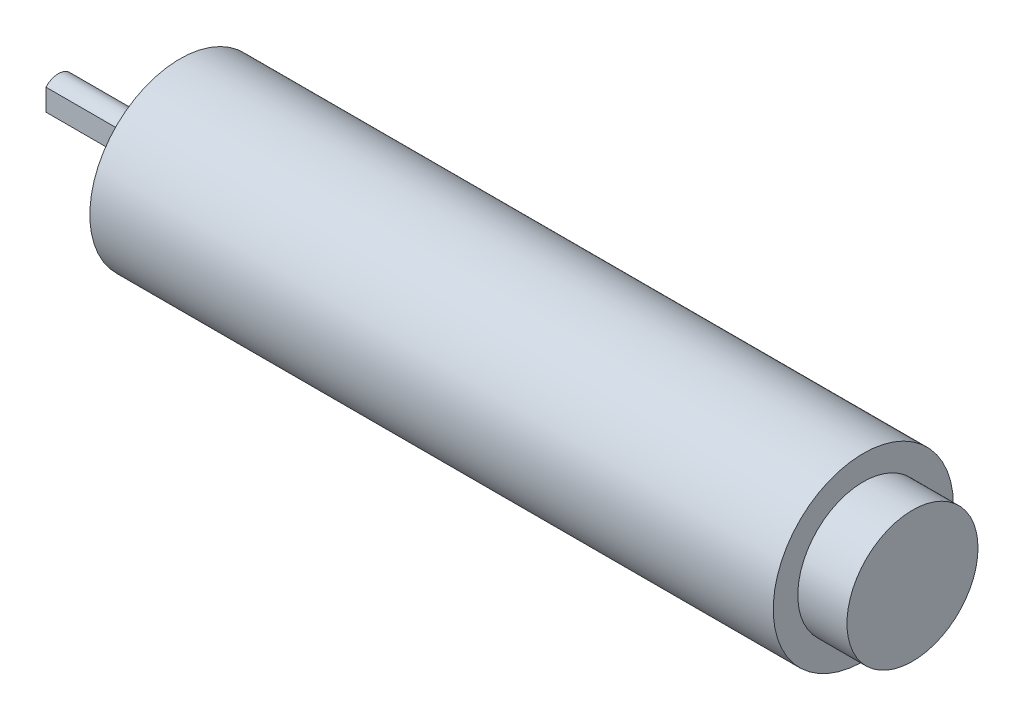
from build123d import *

# Parameters (mm, degrees)
SKETCH1_W           = 52.6
SKETCH1_H           = 11
SKETCH2_R           = 5
BOSS_EXTRUDE1_DEPTH = 1.35
SKETCH3_R           = 3.5
BOSS_EXTRUDE2_DEPTH = 1.8
SKETCH4_R           = 2
BOSS_EXTRUDE3_DEPTH = 11.7
CUT_EXTRUDE1_REACH  = 71.221
HOLE1_D             = 1.95
HOLE1_DEPTH         = 6.5
HOLE2_D             = 1.95
HOLE2_DEPTH         = 6.5
HOLE3_D             = 1.95
HOLE3_DEPTH         = 6.5
HOLE4_D             = 7
HOLE4_DEPTH         = 6.4
HOLE5_D             = 2.1
HOLE5_DEPTH         = 3
HOLE6_D             = 2.1
HOLE6_DEPTH         = 3
HOLE7_D             = 2.1
HOLE7_DEPTH         = 3
SKETCH25_R          = 11
BOSS_EXTRUDE4_DEPTH = 36.83
SKETCH26_R          = 12
SKETCH26_R_2        = 8
CUT_EXTRUDE2_DEPTH  = 6


with BuildPart() as part:
    # Sketch1 → Revolve1 (revolve)
    with BuildSketch(Plane.XY):
        with Locations((26.3, 5.5)):
            Rectangle(SKETCH1_W, SKETCH1_H)
    revolve(axis=Axis((0, 0, 0), (1, 0, 0)))

    # Sketch2 → Boss-Extrude1 (add)
    with BuildSketch(Plane.ZY):
        Circle(SKETCH2_R)
    extrude(amount=BOSS_EXTRUDE1_DEPTH)

    # Sketch3 → Boss-Extrude2 (add)
    with BuildSketch(Plane.ZY.offset(1.35)):
        Circle(SKETCH3_R)
    extrude(amount=BOSS_EXTRUDE2_DEPTH)

    # Sketch4 → Boss-Extrude3 (add)
    with BuildSketch(Plane.ZY.offset(3.15)):
        Circle(SKETCH4_R)
    extrude(amount=BOSS_EXTRUDE3_DEPTH)

    # Cut-Extrude1: up to this plane
    cut_extrude1_end = Plane(origin=(-3.675, 0, 3.675), z_dir=(0.707106781186547, 0, -0.707106781186548))
    # Sketch6 → Cut-Extrude1 (cut, up to the surface)
    with BuildSketch(Plane.ZY.offset(14.85), mode=Mode.PRIVATE) as cut_extrude1_sk1:
        with BuildLine():
            Line((1.5, 1.322875656), (1.5, -1.322875656))
            ThreePointArc((1.5, -1.322875656), (2, 0), (1.5, 1.322875656))
        make_face()
    cut_extrude1_tool1 = split(extrude(cut_extrude1_sk1.sketch, amount=-CUT_EXTRUDE1_REACH, mode=Mode.PRIVATE), bisect_by=cut_extrude1_end, keep=Keep.BOTH, mode=Mode.PRIVATE)
    add(cut_extrude1_tool1.solids().sort_by_distance((-14.85, 0, 1.702311))[0], mode=Mode.SUBTRACT)

    # Hole1
    with Locations(Plane.ZY):
        with Locations((7, 0)):
            Hole(HOLE1_D / 2, depth=HOLE1_DEPTH)

    # Hole2
    with Locations(Plane.ZY):
        with Locations((-3.5, -6.062177826)):
            Hole(HOLE2_D / 2, depth=HOLE2_DEPTH)

    # Hole3
    with Locations(Plane.ZY):
        with Locations((-3.5, 6.062177826)):
            Hole(HOLE3_D / 2, depth=HOLE3_DEPTH)

    # Hole4
    with Locations(Plane(origin=(52.6, 0, 0), x_dir=(0, 0, -1), z_dir=(1, 0, 0))):
        with Locations((0, 0)):
            Hole(HOLE4_D / 2, depth=HOLE4_DEPTH)

    # Hole5
    with Locations(Plane(origin=(52.6, 0, 0), x_dir=(0, 0, -1), z_dir=(1, 0, 0))):
        with Locations((-8.5, 0)):
            Hole(HOLE5_D / 2, depth=HOLE5_DEPTH)

    # Hole6
    with Locations(Plane(origin=(52.6, 0, 0), x_dir=(0, 0, -1), z_dir=(1, 0, 0))):
        with Locations((4.25, -7.361215932)):
            Hole(HOLE6_D / 2, depth=HOLE6_DEPTH)

    # Hole7
    with Locations(Plane(origin=(52.6, 0, 0), x_dir=(0, 0, -1), z_dir=(1, 0, 0))):
        with Locations((4.25, 7.361215932)):
            Hole(HOLE7_D / 2, depth=HOLE7_DEPTH)

    # Sketch25 → Boss-Extrude4 (add)
    with BuildSketch(Plane(origin=(52.6, 0, 0), x_dir=(0, 0, -1), z_dir=(1, 0, 0))):
        Circle(SKETCH25_R)
    extrude(amount=BOSS_EXTRUDE4_DEPTH)

    # Sketch26 → Cut-Extrude2 (cut)
    with BuildSketch(Plane(origin=(89.43, 0, 0), x_dir=(0, 0, -1), z_dir=(1, 0, 0))):
        Circle(SKETCH26_R)
        Circle(SKETCH26_R_2, mode=Mode.SUBTRACT)
    extrude(amount=-CUT_EXTRUDE2_DEPTH, mode=Mode.SUBTRACT)


solid = part.part
